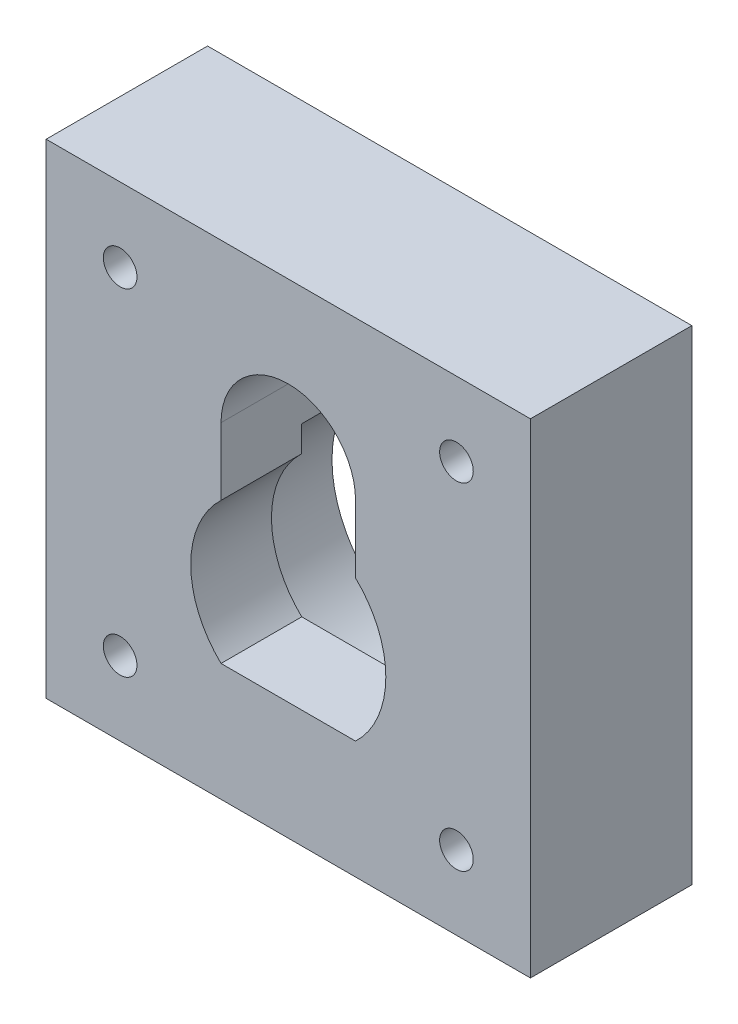
from build123d import *

# Parameters (mm, degrees)
SKETCH1_W             = 36
SKETCH1_H             = 36
BOSS_EXTRUDE1_DEPTH   = 12
SKETCH2_R             = 8.75
CUT_EXTRUDE1_DEPTH    = 6
CUT_EXTRUDE2_REACH    = 28.153
CUT_EXTRUDE3_REACH    = 30.142
M3X0_5_TAPPED_HOLE1_D = 2.5


with BuildPart() as part:
    # Sketch1 → Boss-Extrude1 (new body)
    with BuildSketch(Plane.XY):
        Rectangle(SKETCH1_W, SKETCH1_H)
    extrude(amount=BOSS_EXTRUDE1_DEPTH)

    # Sketch2 → Cut-Extrude1 (cut)
    with BuildSketch(Plane(origin=(0, 0, 0), x_dir=(-1, 0, 0), z_dir=(0, 0, -1))):
        with Locations((0, -4)):
            Circle(SKETCH2_R)
    extrude(amount=-CUT_EXTRUDE1_DEPTH, mode=Mode.SUBTRACT)

    # Sketch3 → Cut-Extrude2 (cut, up to next)
    with BuildSketch(Plane(origin=(0, 0, 6), x_dir=(-1, 0, 0), z_dir=(0, 0, -1)), mode=Mode.PRIVATE) as cut_extrude2_sk1:
        with BuildLine():
            Line((-5, 1.25), (5, 1.25))
            ThreePointArc((5, 1.25), (7.25, -4), (5, -9.25))
            Line((5, -9.25), (-5, -9.25))
            ThreePointArc((-5, -9.25), (-7.25, -4), (-5, 1.25))
        make_face()
    cut_extrude2_tool1 = extrude(cut_extrude2_sk1.sketch, amount=-CUT_EXTRUDE2_REACH, mode=Mode.PRIVATE) & part.part
    add(cut_extrude2_tool1.solids().sort_by_distance((0, -4, 6))[0], mode=Mode.SUBTRACT)

    # Sketch4 → Cut-Extrude3 (cut, up to next)
    with BuildSketch(Plane(origin=(0, 0, 0), x_dir=(-1, 0, 0), z_dir=(0, 0, -1)), mode=Mode.PRIVATE) as cut_extrude3_sk1:
        with BuildLine():
            Line((-5, 6.25), (-5, 1.25))
            Line((-5, 1.25), (5, 1.25))
            Line((5, 1.25), (5, 6.25))
            ThreePointArc((5, 6.25), (0, 11.25), (-5, 6.25))
        make_face()
    cut_extrude3_tool1 = extrude(cut_extrude3_sk1.sketch, amount=-CUT_EXTRUDE3_REACH, mode=Mode.PRIVATE) & part.part
    add(cut_extrude3_tool1.solids().sort_by_distance((0, 5.783251, 0))[0], mode=Mode.SUBTRACT)

    # M3x0.5 Tapped Hole1 (through all)
    with Locations(Plane.XY.offset(12)):
        with Locations((-12.5, -12.5), (12.5, -12.5), (12.5, 12.5), (-12.5, 12.5)):
            Hole(M3X0_5_TAPPED_HOLE1_D / 2)


solid = part.part
